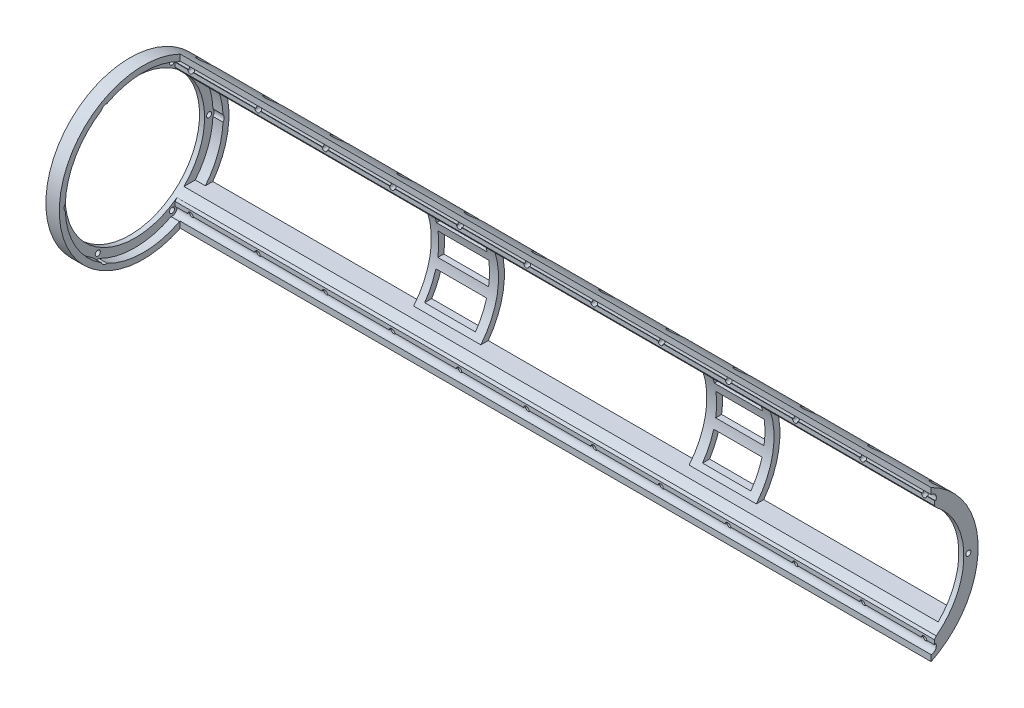
from build123d import *

# Parameters (mm, degrees)
EXTRUDE_1_DEPTH        = 455
EXTRUDE_2_DEPTH        = 3
SKETCH_3_R             = 1.51
CUT_EXTRUDE_1_DEPTH    = 10
CUT_EXTRUDE_7_DEPTH    = 6
SKETCH_7_W             = 30.229729568
SKETCH_7_H             = 14.144185395
SKETCH_7_W_2           = 124
SKETCH_7_H_2           = 59
SKETCH_7_W_3           = 28.754296896
SKETCH_7_H_3           = 13.589511458
SKETCH_7_H_4           = 14.144185394
CUT_EXTRUDE_8_DEPTH    = 100
SKETCH_9_R             = 1.55
CUT_EXTRUDE_11_DEPTH   = 458.948687082
SKETCH_8_R             = 1.55
CUT_EXTRUDE_12_DEPTH   = 458.948687197
EXTRUDE_START          = -3
EXTRUDE_3_DEPTH        = 3
EXTRUDE_4_DEPTH        = 3
SKETCH_15_R            = 1.51
CUT_EXTRUDE_13_DEPTH   = 600
EXTRUDE_START_2        = 449
EXTRUDE_5_DEPTH        = 449
CUT_EXTRUDE_START      = -4
SKETCH_16_R            = 4
CUT_EXTRUDE_14_DEPTH   = 11
PATTERN_LINEAR_2_COUNT = 11
PATTERN_LINEAR_2_PITCH = 40
SKETCH_17_R            = 4
CUT_EXTRUDE_15_DEPTH   = 11
PATTERN_LINEAR_3_COUNT = 11
PATTERN_LINEAR_3_PITCH = 40
SKETCH_19_R            = 50
SKETCH_19_R_2          = 46.5
EXTRUDE_6_DEPTH        = 8
SKETCH_22_R            = 46.5
SKETCH_22_R_2          = 41.5
EXTRUDE_7_DEPTH        = 3
SKETCH_23_R            = 1.525
CUT_EXTRUDE_16_DEPTH   = 3
CUT_EXTRUDE_17_REACH   = 459.498
CUT_EXTRUDE_18_REACH   = 462.462
SKETCH_27_R            = 1.55


with BuildPart() as part:
    # 草图1 → 凸台-拉伸1 (new body)
    with BuildSketch(Plane(origin=(0, 0, 0), x_dir=(0, 0, -1), z_dir=(1, 0, 0))):
        with BuildLine():
            Line((24, -39.827754142), (24, -34.577754142))
            Line((24, -34.577754142), (31.09065645, -34.577754142))
            ThreePointArc((31.09065645, -34.577754142), (46.5, 0), (31.09065645, 34.577754142))
            Line((31.09065645, 34.577754142), (24, 34.577754142))
            Line((24, 34.577754142), (24, 39.827754142))
            ThreePointArc((24, 39.827754142), (23.00704581, 40.409477145), (22, 40.966449688))
            Line((22, 40.966449688), (22, 44.899888641))
            ThreePointArc((22, 44.899888641), (50, 0), (22, -44.899888641))
            Line((22, -44.899888641), (22, -40.966449688))
            ThreePointArc((22, -40.966449688), (23.00704581, -40.409477145), (24, -39.827754142))
        make_face()
    extrude(amount=EXTRUDE_1_DEPTH)

    # 草图2 → 凸台-拉伸2 (add)
    with BuildSketch(Plane.ZY):
        with BuildLine():
            Line((-24, -34.577754142), (-31.09065645, -34.577754142))
            ThreePointArc((-31.09065645, -34.577754142), (-46.5, 0), (-31.09065645, 34.577754142))
            Line((-31.09065645, 34.577754142), (-24, 34.577754142))
            ThreePointArc((-24, 34.577754142), (-24.409954634, 33.749749305), (-25.052063271, 33.085406539))
            ThreePointArc((-25.052063271, 33.085406539), (-41.499999996, -0.000610191), (-25.051090325, -33.086143226))
            ThreePointArc((-25.051090325, -33.086143226), (-24.409436631, -33.75013073), (-24, -34.577754142))
        make_face()
    extrude(amount=-EXTRUDE_2_DEPTH)

    # 草图3 → 切除-拉伸1 (cut)
    with BuildSketch(Plane.ZY):
        with Locations((-44.18, 0)):
            Circle(SKETCH_3_R)
    extrude(amount=-CUT_EXTRUDE_1_DEPTH, mode=Mode.SUBTRACT)

    # 草图5 → 切除-拉伸7 (cut)
    with BuildSketch(Plane(origin=(3, 0, 0), x_dir=(0, 0, -1), z_dir=(1, 0, 0))):
        with BuildLine():
            Line((44.18, 3), (44.18, -3))
            ThreePointArc((44.18, -3), (47.18, 0), (44.18, 3))
        make_face()
    extrude(amount=CUT_EXTRUDE_7_DEPTH, mode=Mode.SUBTRACT)

    # 草图7 → 切除-拉伸8 (cut)
    with BuildSketch(Plane.XY.offset(-24)):
        Polygon((133, -29.5), (9, -29.5), (9, 0), (9, 29.5), (133, 29.5), align=None)
        with Locations((152.510342851, 18.144575017)):
            Rectangle(SKETCH_7_W, SKETCH_7_H)
        with Locations((235, 0)):
            Rectangle(SKETCH_7_W_2, SKETCH_7_H_2)
        with Locations((317.199690844, 18.144575017)):
            Rectangle(SKETCH_7_W_3, SKETCH_7_H)
        Polygon((455, -29.5), (455, 29.5), (337, 29.5), (337, -29.5), (436.492890209, -29.5), align=None)
        with Locations((152.510342851, -0.437001874)):
            Rectangle(SKETCH_7_W, SKETCH_7_H_3)
        with Locations((152.510342851, -19.573252702)):
            Rectangle(SKETCH_7_W, SKETCH_7_H_4)
        with Locations((317.199690844, -0.437001874)):
            Rectangle(SKETCH_7_W_3, SKETCH_7_H_3)
        with Locations((317.199690844, -19.573252702)):
            Rectangle(SKETCH_7_W_3, SKETCH_7_H_4)
    extrude(amount=-CUT_EXTRUDE_8_DEPTH, mode=Mode.SUBTRACT)

    # 草图9 → 切除-拉伸11 (cut, through all)
    with BuildSketch(Plane.XY.offset(-24)):
        with Locations((12, -37.202754142)):
            Circle(SKETCH_9_R)
    cut_extrude_11 = extrude(amount=-CUT_EXTRUDE_11_DEPTH, mode=Mode.SUBTRACT)

    # 草图8 → 切除-拉伸12 (cut, through all)
    with BuildSketch(Plane.XY.offset(-24)):
        with Locations((12, 37.202754142)):
            Circle(SKETCH_8_R)
    cut_extrude_12 = extrude(amount=-CUT_EXTRUDE_12_DEPTH, mode=Mode.SUBTRACT)

    # 草图12 → 凸台-拉伸3 (add)
    with BuildSketch(Plane(origin=(455, 0, 0), x_dir=(0, 0, -1), z_dir=(1, 0, 0)).offset(EXTRUDE_START)):
        with BuildLine():
            Line((22, 44.899888641), (22, 40.966449688))
            ThreePointArc((22, 40.966449688), (46.5, 0), (22, -40.966449688))
            Line((22, -40.966449688), (22, -44.899888641))
            ThreePointArc((22, -44.899888641), (50, 0), (22, 44.899888641))
        make_face()
    extrude(amount=EXTRUDE_3_DEPTH)

    # 草图14 → 凸台-拉伸4 (add)
    with BuildSketch(Plane(origin=(455, 0, 0), x_dir=(0, 0, -1), z_dir=(1, 0, 0)).offset(EXTRUDE_START)):
        with BuildLine():
            Line((31.09065645, 34.577754142), (24, 34.577754142))
            Line((24, 34.577754142), (25.052063271, 33.085406539))
            ThreePointArc((25.052063271, 33.085406539), (41.499999996, -0.000610191), (25.051090325, -33.086143226))
            Line((25.051090325, -33.086143226), (24, -34.577754142))
            Line((24, -34.577754142), (31.09065645, -34.577754142))
            ThreePointArc((31.09065645, -34.577754142), (46.5, 0), (31.09065645, 34.577754142))
        make_face()
    extrude(amount=EXTRUDE_4_DEPTH)

    # 草图15 → 切除-拉伸13 (cut)
    with BuildSketch(Plane.ZY):
        with Locations((-44.18, 0)):
            Circle(SKETCH_15_R)
    extrude(amount=-CUT_EXTRUDE_13_DEPTH, mode=Mode.SUBTRACT)

    # 草图18 → 凸台-拉伸5 (add)
    with BuildSketch(Plane.ZY.offset(-452).offset(EXTRUDE_START_2)):
        with BuildLine():
            Line((-35.944401511, -29.5), (-29.189039039, -29.5))
            ThreePointArc((-29.189039039, -29.5), (-27.179275453, -31.361393238), (-25.051090325, -33.086143226))
            Line((-25.051090325, -33.086143226), (-24, -34.577754142))
            Line((-24, -34.577754142), (-31.09065645, -34.577754142))
            ThreePointArc((-31.09065645, -34.577754142), (-33.613548544, -32.130660657), (-35.944401511, -29.5))
        make_face()
        with BuildLine():
            Line((-35.944401511, 29.5), (-29.189039039, 29.5))
            ThreePointArc((-29.189039039, 29.5), (-27.179736569, 31.360993608), (-25.052063271, 33.085406539))
            Line((-25.052063271, 33.085406539), (-24, 34.577754142))
            Line((-24, 34.577754142), (-31.09065645, 34.577754142))
            ThreePointArc((-31.09065645, 34.577754142), (-33.613548544, 32.130660657), (-35.944401511, 29.5))
        make_face()
    extrude(amount=-EXTRUDE_5_DEPTH)

    # 草图16 → 切除-拉伸14 (cut)
    with BuildSketch(Plane.XY.offset(-24).offset(CUT_EXTRUDE_START)):
        with Locations((12, 37.202754142)):
            Circle(SKETCH_16_R)
        with Locations((448.8, 37.202754142)):
            Circle(SKETCH_16_R)
        with Locations((448.8, -37.202754142)):
            Circle(SKETCH_16_R)
    cut_extrude_14 = extrude(amount=-CUT_EXTRUDE_14_DEPTH, mode=Mode.SUBTRACT)

    # 阵列(线性)2: 切除-拉伸11, 切除-拉伸14 ×11
    with Locations(*[(i * PATTERN_LINEAR_2_PITCH, 0, 0) for i in range(1, PATTERN_LINEAR_2_COUNT)]):
        add(cut_extrude_11, mode=Mode.SUBTRACT)
        add(cut_extrude_14, mode=Mode.SUBTRACT)

    # 草图17 → 切除-拉伸15 (cut)
    with BuildSketch(Plane.XY.offset(-24).offset(CUT_EXTRUDE_START)):
        with Locations((12, -37.202754142)):
            Circle(SKETCH_17_R)
    cut_extrude_15 = extrude(amount=-CUT_EXTRUDE_15_DEPTH, mode=Mode.SUBTRACT)

    # 阵列(线性)3: 切除-拉伸12, 切除-拉伸15 ×11
    with Locations(*[(i * PATTERN_LINEAR_3_PITCH, 0, 0) for i in range(1, PATTERN_LINEAR_3_COUNT)]):
        add(cut_extrude_12, mode=Mode.SUBTRACT)
        add(cut_extrude_15, mode=Mode.SUBTRACT)

    # 草图19 → 凸台-拉伸6 (add)
    with BuildSketch(Plane(origin=(0, 0, 0), x_dir=(0, 0, -1), z_dir=(1, 0, 0))):
        with Locations(Location((0, 0, 0), (0, 0, 63.896118863))):
            Circle(SKETCH_19_R)
        Circle(SKETCH_19_R_2, mode=Mode.SUBTRACT)
    extrude(amount=EXTRUDE_6_DEPTH)

    # 草图22 → 凸台-拉伸7 (add)
    with BuildSketch(Plane(origin=(0, 0, 0), x_dir=(0, 0, -1), z_dir=(1, 0, 0))):
        Circle(SKETCH_22_R)
        with Locations(Location((0, 0, 0), (0, 0, 180))):
            Circle(SKETCH_22_R_2, mode=Mode.SUBTRACT)
    extrude(amount=EXTRUDE_7_DEPTH)

    # 草图23 → 切除-拉伸16 (cut)
    with BuildSketch(Plane(origin=(0, 0, 0), x_dir=(0, 0, -1), z_dir=(1, 0, 0))):
        with Locations((44.18, 0)):
            Circle(SKETCH_23_R)
        with Locations((22.0905, -38.260136314)):
            Circle(SKETCH_23_R)
        with Locations((-22.0885, -38.260136314)):
            Circle(SKETCH_23_R)
        with Locations((-44.178, 0)):
            Circle(SKETCH_23_R)
        with Locations((-22.0885, 38.260136314)):
            Circle(SKETCH_23_R)
        with Locations((22.0905, 38.260136314)):
            Circle(SKETCH_23_R)
    extrude(amount=CUT_EXTRUDE_16_DEPTH, mode=Mode.SUBTRACT)

    # 草图26 → 切除-拉伸17 (cut, up to next)
    with BuildSketch(Plane(origin=(3, 0, 0), x_dir=(0, 0, -1), z_dir=(1, 0, 0)), mode=Mode.PRIVATE) as cut_extrude_17_sk1:
        with BuildLine():
            Line((44.18, -3), (44.18, 3))
            ThreePointArc((44.18, 3), (47.18, 0), (44.18, -3))
        make_face()
    cut_extrude_17_tool1 = extrude(cut_extrude_17_sk1.sketch, amount=CUT_EXTRUDE_17_REACH, mode=Mode.PRIVATE) & part.part
    # 草图26 → 切除-拉伸17 (cut, up to next)
    with BuildSketch(Plane(origin=(3, 0, 0), x_dir=(0, 0, -1), z_dir=(1, 0, 0)), mode=Mode.PRIVATE) as cut_extrude_17_sk2:
        with BuildLine():
            Line((19.492423789, -39.760136314), (24.688576211, -36.760136314))
            ThreePointArc((24.688576211, -36.760136314), (23.5905, -40.858212525), (19.492423789, -39.760136314))
        make_face()
    cut_extrude_17_tool2 = extrude(cut_extrude_17_sk2.sketch, amount=CUT_EXTRUDE_17_REACH, mode=Mode.PRIVATE) & part.part
    # 草图26 → 切除-拉伸17 (cut, up to next)
    with BuildSketch(Plane(origin=(3, 0, 0), x_dir=(0, 0, -1), z_dir=(1, 0, 0)), mode=Mode.PRIVATE) as cut_extrude_17_sk3:
        with BuildLine():
            Line((-24.686576211, -36.760136314), (-19.490423789, -39.760136314))
            ThreePointArc((-19.490423789, -39.760136314), (-23.5885, -40.858212525), (-24.686576211, -36.760136314))
        make_face()
    cut_extrude_17_tool3 = extrude(cut_extrude_17_sk3.sketch, amount=CUT_EXTRUDE_17_REACH, mode=Mode.PRIVATE) & part.part
    # 草图26 → 切除-拉伸17 (cut, up to next)
    with BuildSketch(Plane(origin=(3, 0, 0), x_dir=(0, 0, -1), z_dir=(1, 0, 0)), mode=Mode.PRIVATE) as cut_extrude_17_sk4:
        with BuildLine():
            Line((-44.178, 3), (-44.178, -3))
            ThreePointArc((-44.178, -3), (-47.178, 0), (-44.178, 3))
        make_face()
    cut_extrude_17_tool4 = extrude(cut_extrude_17_sk4.sketch, amount=CUT_EXTRUDE_17_REACH, mode=Mode.PRIVATE) & part.part
    # 草图26 → 切除-拉伸17 (cut, up to next)
    with BuildSketch(Plane(origin=(3, 0, 0), x_dir=(0, 0, -1), z_dir=(1, 0, 0)), mode=Mode.PRIVATE) as cut_extrude_17_sk5:
        with BuildLine():
            Line((-19.490423789, 39.760136314), (-24.686576211, 36.760136314))
            ThreePointArc((-24.686576211, 36.760136314), (-23.5885, 40.858212525), (-19.490423789, 39.760136314))
        make_face()
    cut_extrude_17_tool5 = extrude(cut_extrude_17_sk5.sketch, amount=CUT_EXTRUDE_17_REACH, mode=Mode.PRIVATE) & part.part
    # 草图26 → 切除-拉伸17 (cut, up to next)
    with BuildSketch(Plane(origin=(3, 0, 0), x_dir=(0, 0, -1), z_dir=(1, 0, 0)), mode=Mode.PRIVATE) as cut_extrude_17_sk6:
        with BuildLine():
            Line((24.688576211, 36.760136314), (19.492423789, 39.760136314))
            ThreePointArc((19.492423789, 39.760136314), (23.5905, 40.858212525), (24.688576211, 36.760136314))
        make_face()
    cut_extrude_17_tool6 = extrude(cut_extrude_17_sk6.sketch, amount=CUT_EXTRUDE_17_REACH, mode=Mode.PRIVATE) & part.part
    add(cut_extrude_17_tool1.solids().sort_by_distance((3, 0, -45.45324))[0], mode=Mode.SUBTRACT)
    add(cut_extrude_17_tool2.solids().sort_by_distance((3, -39.362794, -22.72712))[0], mode=Mode.SUBTRACT)
    add(cut_extrude_17_tool3.solids().sort_by_distance((3, -39.362794, 22.72512))[0], mode=Mode.SUBTRACT)
    add(cut_extrude_17_tool4.solids().sort_by_distance((3, 0, 45.45124))[0], mode=Mode.SUBTRACT)
    add(cut_extrude_17_tool5.solids().sort_by_distance((3, 39.362794, 22.72512))[0], mode=Mode.SUBTRACT)
    add(cut_extrude_17_tool6.solids().sort_by_distance((3, 39.362794, -22.72712))[0], mode=Mode.SUBTRACT)

    # 草图27 → 切除-拉伸18 (cut, up to next)
    with BuildSketch(Plane.XY, mode=Mode.PRIVATE) as cut_extrude_18_sk1:
        with Locations((448.8, 37.157685975)):
            Circle(SKETCH_27_R)
    cut_extrude_18_tool1 = extrude(cut_extrude_18_sk1.sketch, amount=-CUT_EXTRUDE_18_REACH, mode=Mode.PRIVATE) & part.part
    # 草图27 → 切除-拉伸18 (cut, up to next)
    with BuildSketch(Plane.XY, mode=Mode.PRIVATE) as cut_extrude_18_sk2:
        with Locations(Location((448.8, -37.158422661, 0), (0, 0, 0.027231621))):
            Circle(SKETCH_27_R)
    cut_extrude_18_tool2 = extrude(cut_extrude_18_sk2.sketch, amount=-CUT_EXTRUDE_18_REACH, mode=Mode.PRIVATE) & part.part
    add(cut_extrude_18_tool1.solids().sort_by_distance((448.8, 37.157686, 0))[0], mode=Mode.SUBTRACT)
    add(cut_extrude_18_tool2.solids().sort_by_distance((448.8, -37.158423, 0))[0], mode=Mode.SUBTRACT)


solid = part.part
